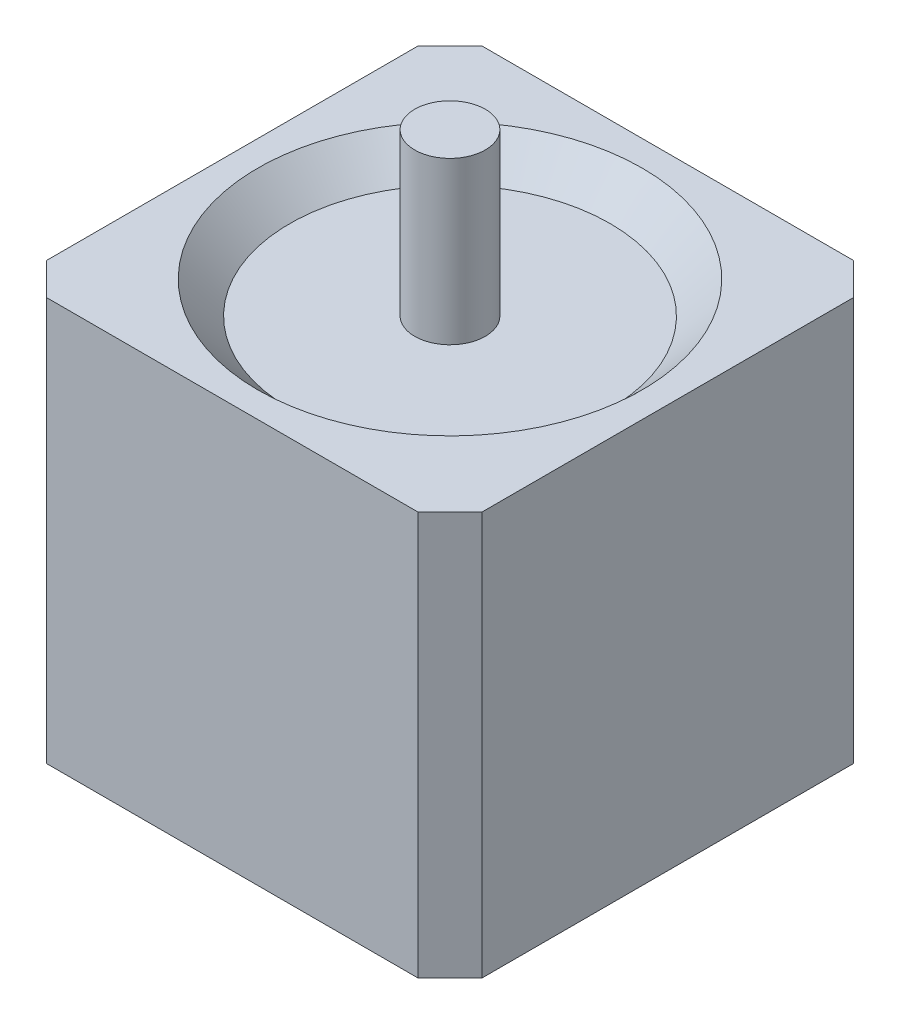
from build123d import *

# Parameters (mm, degrees)
SKETCH1_W           = 86.36
SKETCH1_H           = 86.36
BOSS_EXTRUDE1_DEPTH = 80.01
SKETCH2_R           = 31.75
CUT_EXTRUDE1_DEPTH  = 6.35
CHAMFER1_SIZE       = 6.35
SKETCH3_R           = 6.99897
BOSS_EXTRUDE2_DEPTH = 32.004
CHAMFER2_SIZE       = 6.35


with BuildPart() as part:
    # Sketch1 → Boss-Extrude1 (new body)
    with BuildSketch(Plane(origin=(0, 0, 0), x_dir=(1, 0, 0), z_dir=(0, 1, 0))):
        Rectangle(SKETCH1_W, SKETCH1_H)
    extrude(amount=BOSS_EXTRUDE1_DEPTH)

    # Sketch2 → Cut-Extrude1 (cut)
    with BuildSketch(Plane(origin=(0, 80.01, 0), x_dir=(1, 0, 0), z_dir=(0, 1, 0))):
        with Locations(Location((0, 0, 0), (0, 0, 270))):
            Circle(SKETCH2_R)
    extrude(amount=-CUT_EXTRUDE1_DEPTH, mode=Mode.SUBTRACT)

    # Chamfer1
    chamfer1_edges = [part.edges().sort_by_distance(p)[0] for p in [
        (43.18, 40.005, 43.18),
        (-43.18, 40.005, 43.18),
        (-43.18, 40.005, -43.18),
        (43.18, 40.005, -43.18),
    ]]
    chamfer(chamfer1_edges, length=CHAMFER1_SIZE)

    # Sketch3 → Boss-Extrude2 (add)
    with BuildSketch(Plane(origin=(0, 73.66, 0), x_dir=(1, 0, 0), z_dir=(0, 1, 0))):
        with Locations(Location((0, 0, 0), (0, 0, 270))):
            Circle(SKETCH3_R)
    extrude(amount=BOSS_EXTRUDE2_DEPTH)

    # Chamfer2
    chamfer2_edges = [part.edges().sort_by_distance(p)[0] for p in [
        (0, 80.01, -31.75),
    ]]
    chamfer(chamfer2_edges, length=CHAMFER2_SIZE - 0.0001)  # a hair under: the kernel refuses the full size


solid = part.part
